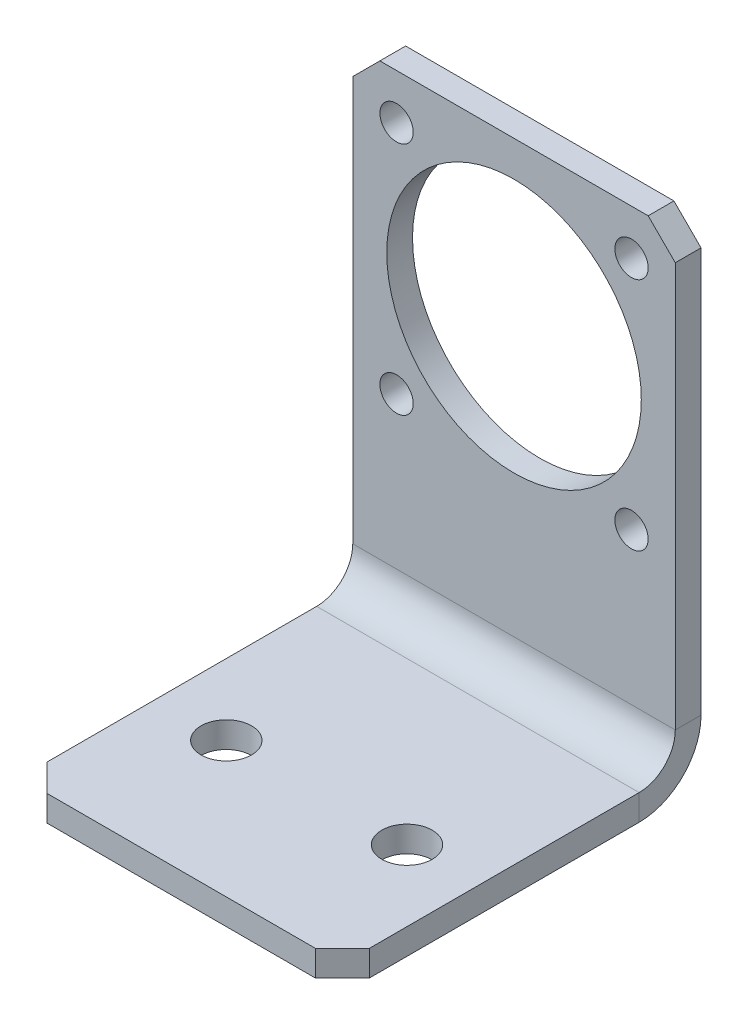
from build123d import *

# Parameters (mm, degrees)
SKETCH_1_W             = 35.69
SKETCH_1_H             = 89.14
SM_BASE_FLANGE_1_DEPTH = 2.85
OTHER_START            = -17.845
OTHER_1_DEPTH          = 35.69
OTHER_1_2_DEPTH        = 35.69
SKETCH_7_R             = 14.0825
SKETCH_7_R_2           = 1.845
CUT_EXTRUDE_1_DEPTH    = 10
CHAMFER_1_SIZE         = 3
SKETCH_8_R             = 2.795
CUT_EXTRUDE_2_DEPTH    = 10


# Read off the part's stored shape, not the designer's step: Нарисованный сгиб1
# Sheet-metal steps are written as plain solids
with BuildPart() as part:
    # Sketch 1 → Базовая кромка1 (new body)
    with BuildSketch(Plane(origin=(0, 0, 0), x_dir=(1, 0, 0), z_dir=(0, 1, 0))):
        Rectangle(SKETCH_1_W, SKETCH_1_H)
    extrude(amount=-SM_BASE_FLANGE_1_DEPTH)

    # Other 1 outline → Other 1 (cut)
    with BuildSketch(Plane.YZ.offset(OTHER_START)):
        with BuildLine():
            Line((0, -44.57), (0, 6.169199698))
            ThreePointArc((0, 6.169199698), (-2.096002789, 8.605700079), (-2.85, 11.73))
            Line((-2.85, 11.73), (-2.85, -44.57))
            Line((-2.85, -44.57), (0, -44.57))
        make_face()
    extrude(amount=OTHER_1_DEPTH, mode=Mode.SUBTRACT)

    # Other 1 2 outline → Other 1 2 (add)
    with BuildSketch(Plane.YZ.offset(OTHER_START)):
        with BuildLine():
            Line((51.778429927, 7.73), (4, 7.73))
            ThreePointArc((4, 7.73), (1.171572875, 8.901572875), (0, 11.73))
            Line((0, 11.73), (0, 6.169199698))
            ThreePointArc((0, 6.169199698), (1.898688751, 5.210261429), (4, 4.88))
            Line((4, 4.88), (51.778429927, 4.88))
            Line((51.778429927, 4.88), (51.778429927, 7.73))
        make_face()
    extrude(amount=OTHER_1_2_DEPTH)

    # Эскиз7 → Вырез-Вытянуть1 (cut)
    with BuildSketch(Plane.XY.offset(7.73)):
        with Locations((0, 33.778429927)):
            Circle(SKETCH_7_R)
        with Locations((13, 46.778429927)):
            Circle(SKETCH_7_R_2)
        with Locations(Location((-13, 46.778429927, 0), (0, 0, 90))):
            Circle(SKETCH_7_R_2)
        with Locations((-13, 20.778429927)):
            Circle(SKETCH_7_R_2)
        with Locations(Location((13, 20.778429927, 0), (0, 0, 90))):
            Circle(SKETCH_7_R_2)
    extrude(amount=-CUT_EXTRUDE_1_DEPTH, mode=Mode.SUBTRACT)

    # Фаска1
    chamfer_1_edges = [part.edges().sort_by_distance(p)[0] for p in [
        (17.845, -1.425, 44.57),
        (-17.845, -1.425, 44.57),
        (-17.845, 51.778429927, 6.305),
        (17.845, 51.778429927, 6.305),
    ]]
    chamfer(chamfer_1_edges, length=CHAMFER_1_SIZE)

    # Эскиз8 → Вырез-Вытянуть2 (cut)
    with BuildSketch(Plane(origin=(0, 0, 0), x_dir=(1, 0, 0), z_dir=(0, 1, 0))):
        with Locations(Location((-10, -29.57, 0), (0, 0, 270))):
            Circle(SKETCH_8_R)
        with Locations(Location((10, -29.57, 0), (0, 0, 90))):
            Circle(SKETCH_8_R)
    extrude(amount=-CUT_EXTRUDE_2_DEPTH, mode=Mode.SUBTRACT)


solid = part.part
